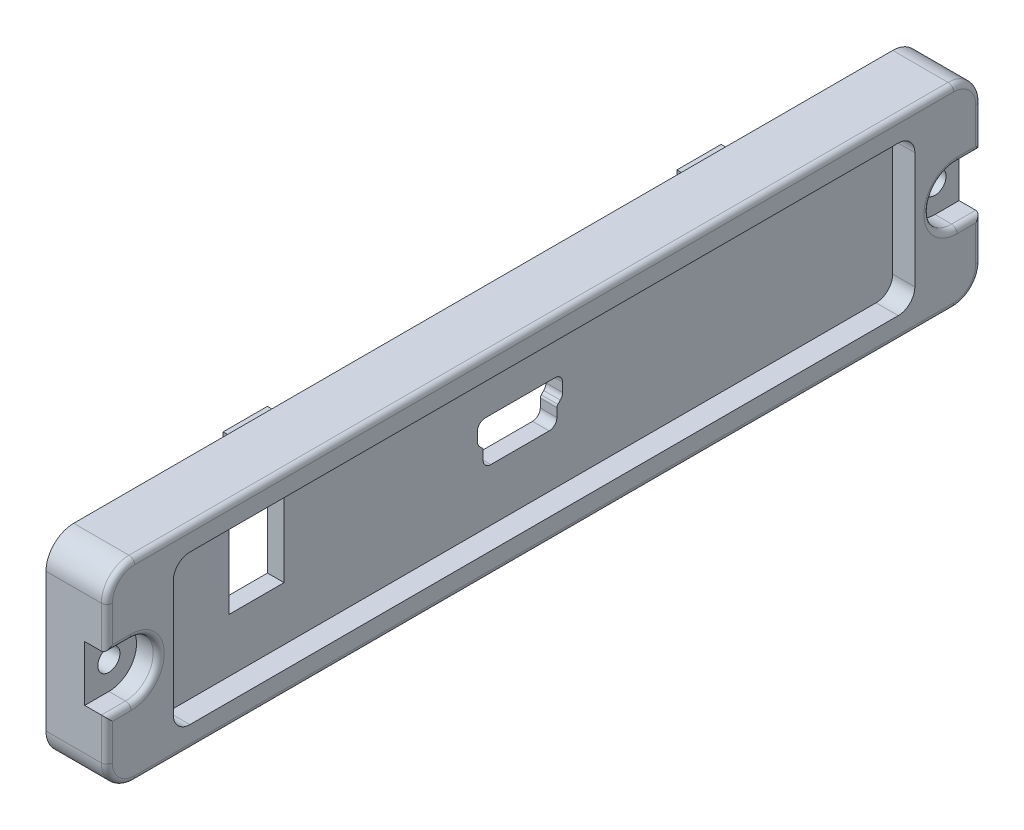
from build123d import *

# Parameters (mm, degrees)
EXTRUIR1_DEPTH            = 5.5
EXTRUIR2_DEPTH            = 2
EXTRUIR3_DEPTH            = 2
CROQUIS5_R                = 1
EXTRUIR4_DEPTH            = 41.608650556
VACIADO1_DEPTH            = 2
VACIADO1_START            = 2
VACIADO1_2_DEPTH          = 2
CROQUIS8_W                = 4
CROQUIS8_H                = 1
EXTRUIR7_DEPTH            = 3
SIMETR_A3_COPY_1_SKETCH_W = 4
SIMETR_A3_COPY_1_SKETCH_H = 1
SIMETR_A3_COPY_1_DEPTH    = 3
REDONDEO1_R               = 0.5
CROQUIS9_W                = 5
CROQUIS9_H                = 7.4
EXTRUIR8_DEPTH            = 41.707032562


# Read off the part's stored shape, not the designer's step: Vaciado1
with BuildPart() as part:
    # Croquis2 → Extruir1 (new body)
    with BuildSketch(Plane(origin=(0, 0, 0), x_dir=(0, 0, -1), z_dir=(1, 0, 0))):
        with BuildLine():
            Line((-37, 8.75), (37, 8.75))
            ThreePointArc((37, 8.75), (38.767766953, 8.017766953), (39.5, 6.25))
            Line((39.5, 6.25), (39.5, -6.25))
            ThreePointArc((39.5, -6.25), (38.767766953, -8.017766953), (37, -8.75))
            Line((37, -8.75), (-37, -8.75))
            ThreePointArc((-37, -8.75), (-38.767766953, -8.017766953), (-39.5, -6.25))
            Line((-39.5, -6.25), (-39.5, 6.25))
            ThreePointArc((-39.5, 6.25), (-38.767766953, 8.017766953), (-37, 8.75))
        make_face()
    extrude(amount=EXTRUIR1_DEPTH)

    # Croquis3 → Extruir2 (cut)
    with BuildSketch(Plane(origin=(5.5, 0, 0), x_dir=(0, 0, -1), z_dir=(1, 0, 0))):
        with BuildLine():
            Line((-32, 6.75), (32, 6.75))
            ThreePointArc((32, 6.75), (33.060660172, 6.310660172), (33.5, 5.25))
            Line((33.5, 5.25), (33.5, -5.25))
            ThreePointArc((33.5, -5.25), (33.060660172, -6.310660172), (32, -6.75))
            Line((32, -6.75), (-32, -6.75))
            ThreePointArc((-32, -6.75), (-33.060660172, -6.310660172), (-33.5, -5.25))
            Line((-33.5, -5.25), (-33.5, 5.25))
            ThreePointArc((-33.5, 5.25), (-33.060660172, 6.310660172), (-32, 6.75))
        make_face()
    extrude(amount=-EXTRUIR2_DEPTH, mode=Mode.SUBTRACT)

    # Croquis4 → Extruir3 (cut)
    with BuildSketch(Plane(origin=(5.5, 0, 0), x_dir=(0, 0, -1), z_dir=(1, 0, 0))):
        with BuildLine():
            Line((-39.5, 2.5), (-37.32, 2.5))
            ThreePointArc((-37.32, 2.5), (-34.82, 0), (-37.32, -2.5))
            Line((-37.32, -2.5), (-39.5, -2.5))
            Line((-39.5, -2.5), (-39.5, 2.5))
        make_face()
    extruir3 = extrude(amount=-EXTRUIR3_DEPTH, mode=Mode.SUBTRACT)

    # Croquis5 → Extruir4 (cut, through all)
    with BuildSketch(Plane(origin=(3.5, 0, 0), x_dir=(0, 0, -1), z_dir=(1, 0, 0))):
        with Locations((-37.32, 0)):
            Circle(CROQUIS5_R)
    extruir4 = extrude(amount=-EXTRUIR4_DEPTH, mode=Mode.SUBTRACT)

    # Simetría1: Extruir3, Extruir4 across plane
    add(extruir3.mirror(Plane.XY), mode=Mode.SUBTRACT)
    add(extruir4.mirror(Plane.XY), mode=Mode.SUBTRACT)

    # Vaciado1 outline → Vaciado1 (cut)
    with BuildSketch(Plane.YZ):
        with BuildLine():
            ThreePointArc((-7.25, -37), (-6.957106781, -37.707106781), (-6.25, -38))
            Line((-6.25, -38), (-2.405743128, -38))
            ThreePointArc((-2.405743128, -38), (0, -34.82), (2.405743128, -38))
            Line((2.405743128, -38), (6.25, -38))
            ThreePointArc((6.25, -38), (6.957106781, -37.707106781), (7.25, -37))
            Line((7.25, -37), (7.25, 37))
            ThreePointArc((7.25, 37), (6.957106781, 37.707106781), (6.25, 38))
            Line((6.25, 38), (2.405743128, 38))
            ThreePointArc((2.405743128, 38), (0, 34.82), (-2.405743128, 38))
            Line((-2.405743128, 38), (-6.25, 38))
            ThreePointArc((-6.25, 38), (-6.957106781, 37.707106781), (-7.25, 37))
            Line((-7.25, 37), (-7.25, -37))
        make_face()
    extrude(amount=VACIADO1_DEPTH, mode=Mode.SUBTRACT)

    # Vaciado1 2 outline → Vaciado1 2 (cut)
    with BuildSketch(Plane.YZ.offset(VACIADO1_START)):
        with BuildLine():
            Line((-7.25, -34.236067977), (-7.25, -37))
            ThreePointArc((-7.25, -37), (-6.957106781, -37.707106781), (-6.25, -38))
            Line((-6.25, -38), (-4, -38))
            Line((-4, -38), (-4, -37.32))
            ThreePointArc((-4, -37.32), (-3.810109158, -36.102187122), (-3.258465897, -35))
            Line((-3.258465897, -35), (-5.25, -35))
            ThreePointArc((-5.25, -35), (-6.320466269, -34.802517077), (-7.25, -34.236067977))
        make_face()
        with BuildLine():
            Line((-7.25, 37), (-7.25, 34.236067977))
            ThreePointArc((-7.25, 34.236067977), (-6.320466269, 34.802517077), (-5.25, 35))
            Line((-5.25, 35), (-3.258465897, 35))
            ThreePointArc((-3.258465897, 35), (-3.810109158, 36.102187122), (-4, 37.32))
            Line((-4, 37.32), (-4, 38))
            Line((-4, 38), (-6.25, 38))
            ThreePointArc((-6.25, 38), (-6.957106781, 37.707106781), (-7.25, 37))
        make_face()
        with BuildLine():
            Line((4, -37.32), (4, -38))
            Line((4, -38), (6.25, -38))
            ThreePointArc((6.25, -38), (6.957106781, -37.707106781), (7.25, -37))
            Line((7.25, -37), (7.25, -34.236067977))
            ThreePointArc((7.25, -34.236067977), (6.320466269, -34.802517077), (5.25, -35))
            Line((5.25, -35), (3.258465897, -35))
            ThreePointArc((3.258465897, -35), (3.810109158, -36.102187122), (4, -37.32))
        make_face()
        with BuildLine():
            Line((6.25, 38), (4, 38))
            Line((4, 38), (4, 37.32))
            ThreePointArc((4, 37.32), (3.810109158, 36.102187122), (3.258465897, 35))
            Line((3.258465897, 35), (5.25, 35))
            ThreePointArc((5.25, 35), (6.320466269, 34.802517077), (7.25, 34.236067977))
            Line((7.25, 34.236067977), (7.25, 37))
            ThreePointArc((7.25, 37), (6.957106781, 37.707106781), (6.25, 38))
        make_face()
    extrude(amount=VACIADO1_2_DEPTH, mode=Mode.SUBTRACT)

    # Croquis8 → Extruir7 (add)
    with BuildSketch(Plane.ZY.offset(-2)):
        with Locations((-20.5, 7.65)):
            Rectangle(CROQUIS8_W, CROQUIS8_H)
    extruir7 = extrude(amount=EXTRUIR7_DEPTH)

    # Simetría2: Extruir7 across plane
    add(extruir7.mirror(Plane.XY))

    # Simetría3: Extruir7 across plane
    add(extruir7.mirror(Plane.ZX))

    # Simetría3 copy 1 sketch → Simetría3 copy 1 (add)
    with BuildSketch(Plane(origin=(2, 0, 0), x_dir=(0, 0, -1), z_dir=(-1, 0, 0))):
        with Locations((-20.5, 7.65)):
            Rectangle(SIMETR_A3_COPY_1_SKETCH_W, SIMETR_A3_COPY_1_SKETCH_H)
    extrude(amount=SIMETR_A3_COPY_1_DEPTH)

    # Redondeo1
    redondeo1_edges = [part.edges().sort_by_distance(p)[0] for p in [
        (5.5, -8.017766953, 38.767766953),
        (5.5, -8.75, 0),
        (5.5, -8.017766953, -38.767766953),
        (5.5, -4.375, -39.5),
        (5.5, 8.017766953, -38.767766953),
        (5.5, 8.75, 0),
        (5.5, 8.017766953, 38.767766953),
        (5.5, -4.375, 39.5),
        (5.5, -2.5, 38.41),
        (5.5, 0, 34.82),
        (5.5, 2.5, 38.41),
        (5.5, 4.375, 39.5),
        (5.5, 4.375, -39.5),
        (5.5, -2.5, -38.41),
        (5.5, 0, -34.82),
        (5.5, 2.5, -38.41),
    ]]
    fillet(redondeo1_edges, radius=REDONDEO1_R)

    # Croquis9 → Extruir8 (cut, through all)
    with BuildSketch(Plane(origin=(3.5, 0, 0), x_dir=(0, 0, -1), z_dir=(1, 0, 0))):
        with Locations((-23.987, 1.8)):
            Rectangle(CROQUIS9_W, CROQUIS9_H)
        with BuildLine():
            Line((-4.0245, 0.401469998), (-4.0245, 1.2))
            ThreePointArc((-4.0245, 1.2), (-3.819474747, 1.694974747), (-3.3245, 1.9))
            Line((-3.3245, 1.9), (2.9755, 1.9))
            ThreePointArc((2.9755, 1.9), (3.470474747, 1.694974747), (3.6755, 1.2))
            Line((3.6755, 1.2), (3.6755, 0.401469998))
            ThreePointArc((3.6755, 0.401469998), (3.622215673, 0.133591595), (3.470474747, -0.093504749))
            Line((3.470474747, -0.093504749), (3.246579496, -0.3174))
            ThreePointArc((3.246579496, -0.3174), (3.18154767, -0.414727005), (3.15871153, -0.529532034))
            Line((3.15871153, -0.529532034), (3.15871153, -1.3))
            ThreePointArc((3.15871153, -1.3), (2.953686277, -1.794974747), (2.45871153, -2))
            Line((2.45871153, -2), (-2.80771153, -2))
            ThreePointArc((-2.80771153, -2), (-3.302686277, -1.794974747), (-3.50771153, -1.3))
            Line((-3.50771153, -1.3), (-3.50771153, -0.529532034))
            ThreePointArc((-3.50771153, -0.529532034), (-3.53054767, -0.414727005), (-3.595579496, -0.3174))
            Line((-3.595579496, -0.3174), (-3.819474747, -0.093504749))
            ThreePointArc((-3.819474747, -0.093504749), (-3.971215673, 0.133591595), (-4.0245, 0.401469998))
        make_face()
    extrude(amount=-EXTRUIR8_DEPTH, mode=Mode.SUBTRACT)


solid = part.part
